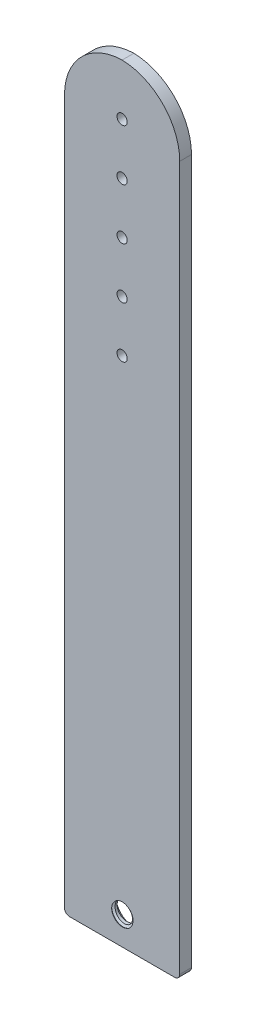
from build123d import *

# Parameters (mm, degrees)
SKETCH1_W           = 22.5
SKETCH1_H           = 150
SKETCH1_R           = 1
BOSS_EXTRUDE1_DEPTH = 2.3
FILLET1_R           = 11.5
THREAD1_PITCH       = 0.79375
FILLET2_R           = 1


with BuildPart() as part:
    # Sketch1 → Boss-Extrude1 (new body)
    with BuildSketch(Plane.XY):
        with Locations((0, 75)):
            Rectangle(SKETCH1_W, SKETCH1_H)
        with Locations((0, 140)):
            Circle(SKETCH1_R, mode=Mode.SUBTRACT)
        with Locations((0, 130)):
            Circle(SKETCH1_R, mode=Mode.SUBTRACT)
        with Locations((0, 120)):
            Circle(SKETCH1_R, mode=Mode.SUBTRACT)
        with Locations((0, 110)):
            Circle(SKETCH1_R, mode=Mode.SUBTRACT)
        with Locations((0, 100)):
            Circle(SKETCH1_R, mode=Mode.SUBTRACT)
    extrude(amount=BOSS_EXTRUDE1_DEPTH)

    # Fillet1
    # the kernel refuses this fillet: 11.5 mm, written as the material it takes off along each edge
    with BuildSketch(Plane(origin=(11.25, 150, -28.75), x_dir=(0, -1, 0), z_dir=(0, 0, 1)), Plane(origin=(-11.25, 150, -28.75), x_dir=(1, 0, 0), z_dir=(0, 0, 1))) as fillet1_piece_1:
        with BuildLine():
            CenterArc((FILLET1_R, -FILLET1_R), FILLET1_R, 90, 90)
            Line((0, -FILLET1_R), (0, 0))
            Line((0, 0), (FILLET1_R, 0))
        make_face()
    extrude(amount=59.8, mode=Mode.SUBTRACT)

    # Sketch3 → CSK for #6 Flat Head Machine Screw (100)1 (revolve, cut)
    with BuildSketch(Plane(origin=(0, 5.75, 0), x_dir=(0, 1, 0), z_dir=(1, 0, 0))):
        Polygon((0, 0), (0, 2.3), (1.89865, 2.3), (1.89865, 1.380025208), (3.5433, 0), align=None)
    revolve(axis=Axis((0, 5.75, -6.35), (0, 0, 1)), mode=Mode.SUBTRACT)

    # Thread1: the profile of Thread Profile1 profile screwed along a right-hand helix of 1.159023 turns, 8 arcs to a turn; built about Z, then put on its axis
    thread1_z = Axis((0, 0, 0), (0, 0, 1))
    thread1_corners = [(1.89835, 0, -0.000173205), (2.328279788, 0, 0.248046874), (2.328279788, 0, 0.347265624), (1.89835, 0, 0.595485703)]
    with BuildLine(mode=Mode.PRIVATE) as thread1_profile:
        Line(thread1_corners[0], thread1_corners[1])
        Line(thread1_corners[1], thread1_corners[2])
        Line(thread1_corners[2], thread1_corners[3])
        Line(thread1_corners[3], thread1_corners[0])
    thread1_cap = Face(thread1_profile.wire())
    thread1_turn_angles = [0, 22.5, 45, 67.5, 90, 112.5, 135, 157.5, 180, 202.5, 225, 247.5, 270, 292.5, 315, 337.5, 360]
    thread1_turn_weights = [1, 0.9238795325112867, 1, 0.9238795325112867, 1, 0.9238795325112867, 1, 0.9238795325112867, 1, 0.9238795325112867, 1, 0.9238795325112867, 1, 0.9238795325112867, 1, 0.9238795325112867, 1]
    thread1_turn_rails = [Edge.make_bspline([Vector(p[0], p[1], 0).rotate(thread1_z, thread1_turn_angles[k]) / thread1_turn_weights[k] + Vector(0, 0, p[2] + THREAD1_PITCH * thread1_turn_angles[k] / 360) for k in range(17)], [0, 0, 0, 1, 1, 2, 2, 3, 3, 4, 4, 5, 5, 6, 6, 7, 7, 8, 8, 8], 2, thread1_turn_weights) for p in thread1_corners]
    thread1_turn_sides = [Face.make_surface_from_curves(thread1_turn_rails[p[0]], thread1_turn_rails[p[1]]) for p in [(0, 1), (1, 2), (2, 3), (3, 0)]]
    thread1_last_angles = [360, 382.5, 405, 411.124204706, 417.248409411]
    thread1_last_weights = [1, 0.9238795325112867, 1, 0.9942929639578035, 1]
    thread1_last_rails = [Edge.make_bspline([Vector(p[0], p[1], 0).rotate(thread1_z, thread1_last_angles[k]) / thread1_last_weights[k] + Vector(0, 0, p[2] + THREAD1_PITCH * thread1_last_angles[k] / 360) for k in range(5)], [0, 0, 0, 1, 1, 2, 2, 2], 2, thread1_last_weights) for p in thread1_corners]
    thread1_last_sides = [Face.make_surface_from_curves(thread1_last_rails[p[0]], thread1_last_rails[p[1]]) for p in [(0, 1), (1, 2), (2, 3), (3, 0)]]
    thread1 = Plane(origin=(0, 5.75, 1.380025208), x_dir=(1, 0, 0), z_dir=(0, 0, 1)) * Solid(Shell([*thread1_turn_sides, *thread1_last_sides, thread1_cap, thread1_cap.rotate(thread1_z, 417.248409411).moved(Location((0, 0, THREAD1_PITCH * 417.248409411 / 360)))]))
    add(thread1, mode=Mode.SUBTRACT)

    # Fillet2
    fillet2_edges = [part.edges().sort_by_distance(p)[0] for p in [
        (11.25, 0, 1.15),
        (-11.25, 0, 1.15),
    ]]
    fillet(fillet2_edges, radius=FILLET2_R)


solid = part.part
